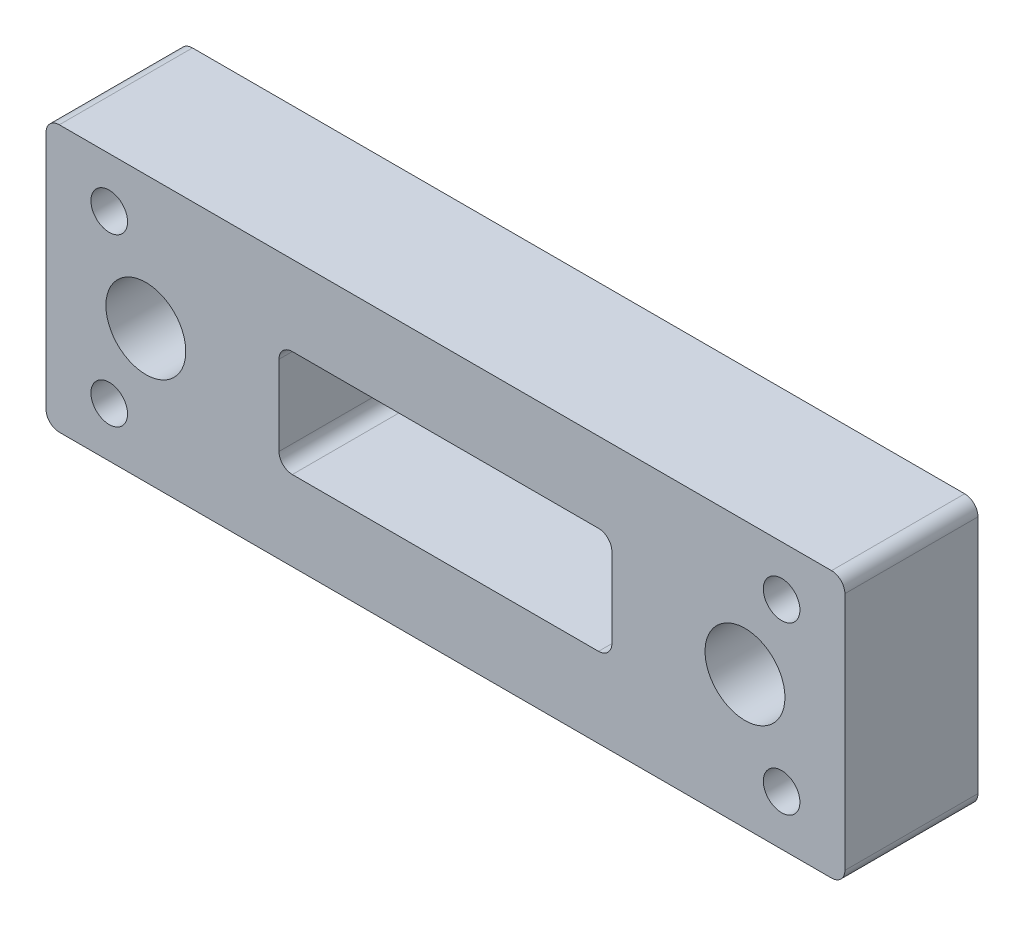
from build123d import *

# Parameters (mm, degrees)
SKETCH_1_W          = 120
SKETCH_1_H          = 40
EXTRUDE_1_DEPTH     = 20
SKETCH_2_R          = 6
SKETCH_2_R_2        = 2.75
CUT_EXTRUDE_1_DEPTH = 20
FILLET_1_R          = 2
SKETCH_3_W          = 50
SKETCH_3_H          = 16
CUT_EXTRUDE_2_DEPTH = 67.332495807
FILLET_2_R          = 2


with BuildPart() as part:
    # 草图1 → 凸台-拉伸1 (new body)
    with BuildSketch(Plane.XY):
        Rectangle(SKETCH_1_W, SKETCH_1_H)
    extrude(amount=EXTRUDE_1_DEPTH)

    # 草图2 → 切除-拉伸1 (cut)
    with BuildSketch(Plane.XY.offset(20)):
        with Locations((45, 0)):
            Circle(SKETCH_2_R)
        with Locations((50.5, 12.5)):
            Circle(SKETCH_2_R_2)
        with Locations((50.5, -12.5)):
            Circle(SKETCH_2_R_2)
        with Locations((-50.5, -12.5)):
            Circle(SKETCH_2_R_2)
        with Locations((-50.5, 12.5)):
            Circle(SKETCH_2_R_2)
        with Locations((-45, 0)):
            Circle(SKETCH_2_R)
    extrude(amount=-CUT_EXTRUDE_1_DEPTH, mode=Mode.SUBTRACT)

    # 圆角1
    fillet_1_edges = [part.edges().sort_by_distance(p)[0] for p in [
        (-60, 20, 10),
        (-60, -20, 10),
        (60, 20, 10),
        (60, -20, 10),
    ]]
    fillet(fillet_1_edges, radius=FILLET_1_R)

    # 草图3 → 切除-拉伸2 (cut, through all)
    with BuildSketch(Plane.XY.offset(20)):
        Rectangle(SKETCH_3_W, SKETCH_3_H)
    extrude(amount=-CUT_EXTRUDE_2_DEPTH, mode=Mode.SUBTRACT)

    # 圆角2
    fillet_2_edges = [part.edges().sort_by_distance(p)[0] for p in [
        (25, -8, 10),
        (-25, -8, 10),
        (-25, 8, 10),
        (25, 8, 10),
    ]]
    fillet(fillet_2_edges, radius=FILLET_2_R)


solid = part.part
